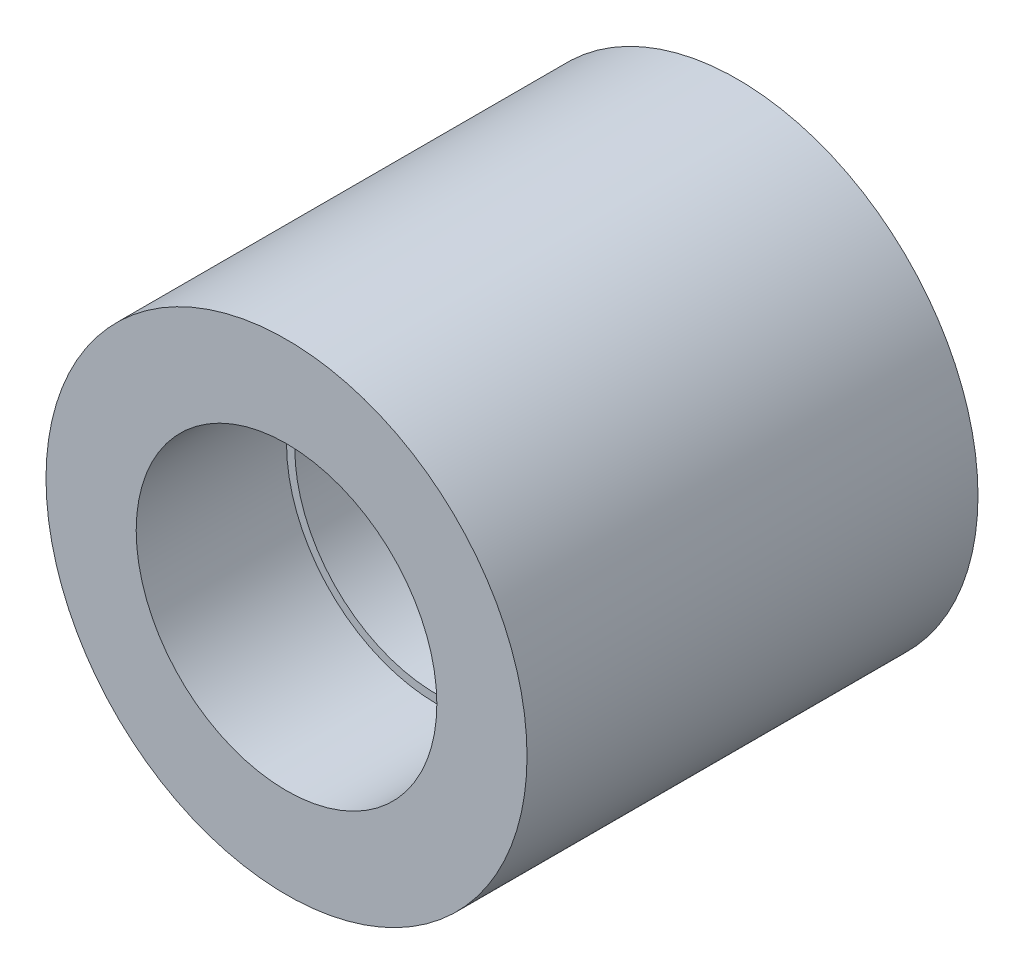
from build123d import *

# Parameters (mm, degrees)
SKETCH1_R           = 5.08
SKETCH1_R_2         = 3.175
BOSS_EXTRUDE1_DEPTH = 3.175
BOSS_EXTRUDE2_START = -6.35
SKETCH1_3_R         = 5.08
SKETCH1_3_R_2       = 3
BOSS_EXTRUDE2_DEPTH = 6.35


with BuildPart() as part:
    # Sketch1 → Boss-Extrude1 (new body)
    with BuildSketch(Plane.XY):
        Circle(SKETCH1_R)
        Circle(SKETCH1_R_2, mode=Mode.SUBTRACT)
    extrude(amount=BOSS_EXTRUDE1_DEPTH)

    # Sketch1<3> → Boss-Extrude2 (add)
    with BuildSketch(Plane.XY.offset(BOSS_EXTRUDE2_START)):
        Circle(SKETCH1_3_R)
        Circle(SKETCH1_3_R_2, mode=Mode.SUBTRACT)
    extrude(amount=BOSS_EXTRUDE2_DEPTH)


solid = part.part
